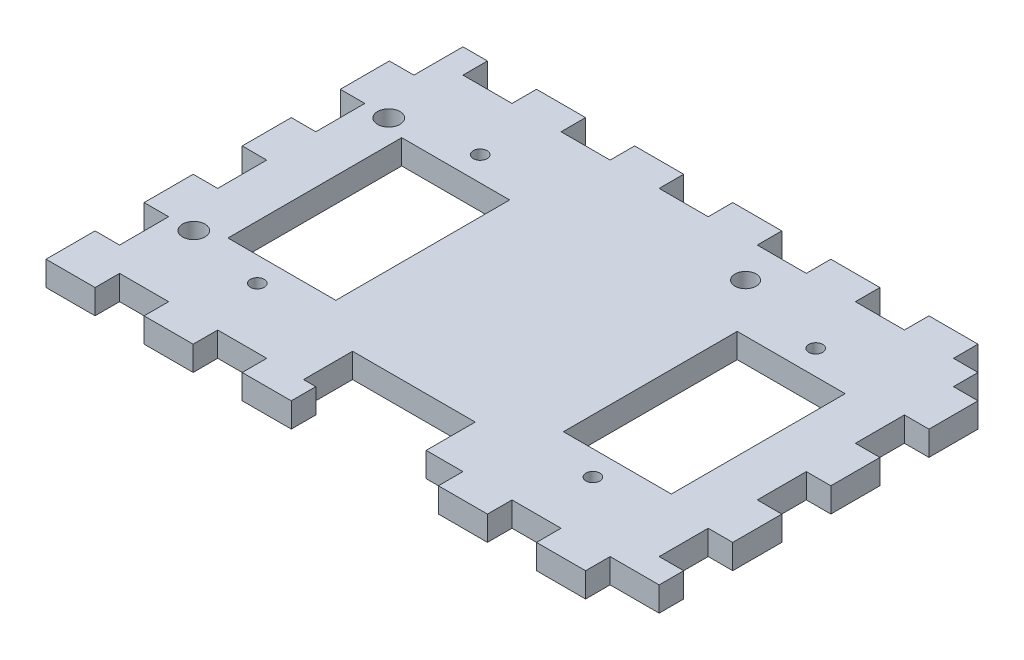
from build123d import *

# Parameters (mm, degrees)
SKETCH1_W                     = 152.4
SKETCH1_H                     = 101.6
BOSS_EXTRUDE2_DEPTH           = 6.35
SKETCH2_W                     = 6.35
SKETCH2_H                     = 12.7
CUT_EXTRUDE2_DEPTH            = 6.35
SKETCH2_4_W                   = 12.7
SKETCH2_4_H                   = 6.35
CUT_EXTRUDE3_DEPTH            = 6.35
SKETCH9_W                     = 27.94
SKETCH9_H                     = 45
CUT_EXTRUDE4_DEPTH            = 184.272045059
SKETCH12_W                    = 31.75
SKETCH12_H                    = 12.7
CUT_EXTRUDE6_DEPTH            = 184.272045059
SKETCH21_W                    = 2.9
SKETCH21_H                    = 6.35
M5_CLEARANCE_HOLE2_AT_2_COUNT = 2
M5_CLEARANCE_HOLE2_AT_2_PITCH = 50.48
SKETCH30_W                    = 2.75
SKETCH30_H                    = 6.35
M3_CLEARANCE_HOLE1_D          = 3.6


with BuildPart() as part:
    # Sketch1 → Boss-Extrude2 (new body)
    with BuildSketch(Plane(origin=(0, 0, 0), x_dir=(1, 0, 0), z_dir=(0, 1, 0))):
        with Locations((76.2, 50.8)):
            Rectangle(SKETCH1_W, SKETCH1_H)
    extrude(amount=BOSS_EXTRUDE2_DEPTH)

    # Sketch2 → Cut-Extrude2 (cut)
    with BuildSketch(Plane(origin=(0, 6.35, 0), x_dir=(1, 0, 0), z_dir=(0, 1, 0))):
        with Locations((3.175, 95.25)):
            Rectangle(SKETCH2_W, SKETCH2_H)
        with Locations((3.175, 69.85)):
            Rectangle(SKETCH2_W, SKETCH2_H)
        with Locations((3.175, 44.45)):
            Rectangle(SKETCH2_W, SKETCH2_H)
        with Locations((3.175, 19.05)):
            Rectangle(SKETCH2_W, SKETCH2_H)
    cut_extrude2 = extrude(amount=-CUT_EXTRUDE2_DEPTH, mode=Mode.SUBTRACT)

    # Mirror1: Cut-Extrude2 across plane
    add(cut_extrude2.mirror(Plane.ZY.offset(-76.2)), mode=Mode.SUBTRACT)

    # Sketch2<4> → Cut-Extrude3 (cut)
    with BuildSketch(Plane(origin=(0, 6.35, 0), x_dir=(1, 0, 0), z_dir=(0, 1, 0))):
        with Locations((19.05, 98.425)):
            Rectangle(SKETCH2_4_W, SKETCH2_4_H)
        with Locations((44.45, 98.425)):
            Rectangle(SKETCH2_4_W, SKETCH2_4_H)
        with Locations((69.85, 98.425)):
            Rectangle(SKETCH2_4_W, SKETCH2_4_H)
        with Locations((95.25, 98.425)):
            Rectangle(SKETCH2_4_W, SKETCH2_4_H)
        with Locations((146.05, 98.425)):
            Rectangle(SKETCH2_4_W, SKETCH2_4_H)
        with Locations((120.65, 98.425)):
            Rectangle(SKETCH2_4_W, SKETCH2_4_H)
    cut_extrude3 = extrude(amount=-CUT_EXTRUDE3_DEPTH, mode=Mode.SUBTRACT)

    # Mirror2: Cut-Extrude3 across plane
    add(cut_extrude3.mirror(Plane(origin=(0, 0, -50.8), x_dir=(1, 0, 0), z_dir=(0, 0, -1))), mode=Mode.SUBTRACT)

    # Sketch9 → Cut-Extrude4 (cut, through all)
    with BuildSketch(Plane(origin=(0, 6.35, 0), x_dir=(1, 0, 0), z_dir=(0, 1, 0))):
        with Locations((32.766, 50.8)):
            Rectangle(SKETCH9_W, SKETCH9_H)
        with Locations((119.634, 50.8)):
            Rectangle(SKETCH9_W, SKETCH9_H)
    extrude(amount=-CUT_EXTRUDE4_DEPTH, mode=Mode.SUBTRACT)

    # Sketch12 → Cut-Extrude6 (cut, through all)
    with BuildSketch(Plane(origin=(0, 6.35, 0), x_dir=(1, 0, 0), z_dir=(0, 1, 0))):
        with Locations((76.2, 12.7)):
            Rectangle(SKETCH12_W, SKETCH12_H)
    extrude(amount=-CUT_EXTRUDE6_DEPTH, mode=Mode.SUBTRACT)


with BuildPart() as cut_extrude6_piece_1:
    # of the separate pieces the step leaves, piece 1, a body of its own (cut_extrude6_pieces)
    add(part.part.solids().sort_by_distance((0, 0, -88.9))[0])

    # Sketch21 → M5 Clearance Hole2 (revolve, cut)
    with BuildSketch(Plane(origin=(12.7, 0, -76.04), x_dir=(0, 0, -1), z_dir=(1, 0, 0))):
        with Locations((1.45, 3.175)):
            Rectangle(SKETCH21_W, SKETCH21_H)
    m5_clearance_hole2 = revolve(axis=Axis((12.7, -6.35, -76.04), (0, 1, 0)), mode=Mode.SUBTRACT)

    # M5 Clearance Hole2 at 2: M5 Clearance Hole2 ×2
    with Locations(*[(0, 0, i * M5_CLEARANCE_HOLE2_AT_2_PITCH) for i in range(1, M5_CLEARANCE_HOLE2_AT_2_COUNT)]):
        add(m5_clearance_hole2, mode=Mode.SUBTRACT)

    # Sketch30 → M5 Clearance Hole3 (revolve, cut)
    with BuildSketch(Plane(origin=(95.25, 0, -85.8774), x_dir=(0, 0, -1), z_dir=(1, 0, 0))):
        with Locations((1.375, 3.175)):
            Rectangle(SKETCH30_W, SKETCH30_H)
    revolve(axis=Axis((95.25, -6.35, -85.8774), (0, 1, 0)), mode=Mode.SUBTRACT)

    # M3 Clearance Hole1 (through all)
    with Locations(Plane(origin=(0, 6.35, 0), x_dir=(1, 0, 0), z_dir=(0, 1, 0))):
        with Locations((32.766, 79.65), (119.634, 79.65), (119.634, 21.95), (32.766, 21.95)):
            Hole(M3_CLEARANCE_HOLE1_D / 2)


with BuildPart() as cut_extrude6_piece_2:
    # of the separate pieces the step leaves, piece 2, a body of its own (cut_extrude6_pieces)
    add(part.part.solids().sort_by_distance((88.9, 0, -6.35))[0])


solid = cut_extrude6_piece_1.part
